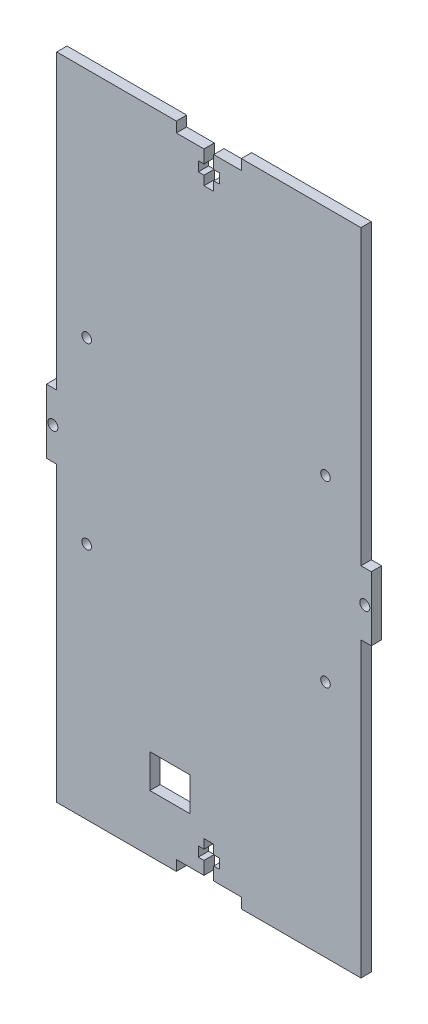
from build123d import *

# Parameters (mm, degrees)
SKETCH1_W           = 100
SKETCH1_H           = 200
BOSS_EXTRUDE2_DEPTH = 3.18
SKETCH2_R           = 1.55
SKETCH2_W           = 3.18
SKETCH2_H           = 90.125
CUT_EXTRUDE1_DEPTH  = 112.84861376
SKETCH4_W           = 12.353553391
SKETCH4_H           = 10.353553391
CUT_EXTRUDE3_DEPTH  = 112.84861376
SKETCH5_R           = 1.47
CUT_EXTRUDE4_DEPTH  = 112.84861376


with BuildPart() as part:
    # Sketch1 → Boss-Extrude2 (new body)
    with BuildSketch(Plane.XY):
        Rectangle(SKETCH1_W, SKETCH1_H)
    extrude(amount=BOSS_EXTRUDE2_DEPTH)

    # Sketch2 → Cut-Extrude1 (cut, through all)
    with BuildSketch(Plane.XY.offset(3.18)):
        with Locations((-48, 0)):
            Circle(SKETCH2_R)
        Polygon((-10, 100), (-10, 96.82), (-1.5, 96.82), (-1.5, 92.82), (-3.25, 92.82), (-3.25, 89.82), (-1.5, 89.82), (-1.5, 87), (1.5, 87), (1.5, 89.82), (3.25, 89.82), (3.25, 92.82), (1.5, 92.82), (1.5, 96.82), (10, 96.82), (10, 100), align=None)
        with Locations((-48.41, 54.9375)):
            Rectangle(SKETCH2_W, SKETCH2_H)
        with Locations((-48.41, -54.9375)):
            Rectangle(SKETCH2_W, SKETCH2_H)
    cut_extrude1 = extrude(amount=-CUT_EXTRUDE1_DEPTH, mode=Mode.SUBTRACT)

    # Mirror1: Cut-Extrude1 across plane
    add(cut_extrude1.mirror(Plane.ZX), mode=Mode.SUBTRACT)

    # Mirror3: Cut-Extrude1 across plane
    add(cut_extrude1.mirror(Plane(origin=(0, 0, 0), x_dir=(0, 0, 1), z_dir=(1, 0, 0))), mode=Mode.SUBTRACT)

    # Sketch4 → Cut-Extrude3 (cut, through all)
    with BuildSketch(Plane.XY.offset(3.18)):
        with Locations((-11.973223305, -77.343223305)):
            Rectangle(SKETCH4_W, SKETCH4_H)
    extrude(amount=-CUT_EXTRUDE3_DEPTH, mode=Mode.SUBTRACT)

    # Sketch5 → Cut-Extrude4 (cut, through all)
    with BuildSketch(Plane.XY.offset(3.18)):
        with Locations((-37.58090562, 28.464149283)):
            Circle(SKETCH5_R)
        with Locations((35.904481485, 28.464149283)):
            Circle(SKETCH5_R)
        with Locations((-37.58090562, -26.535850717)):
            Circle(SKETCH5_R)
        with Locations((35.904481485, -26.535850717)):
            Circle(SKETCH5_R)
    extrude(amount=-CUT_EXTRUDE4_DEPTH, mode=Mode.SUBTRACT)


solid = part.part
